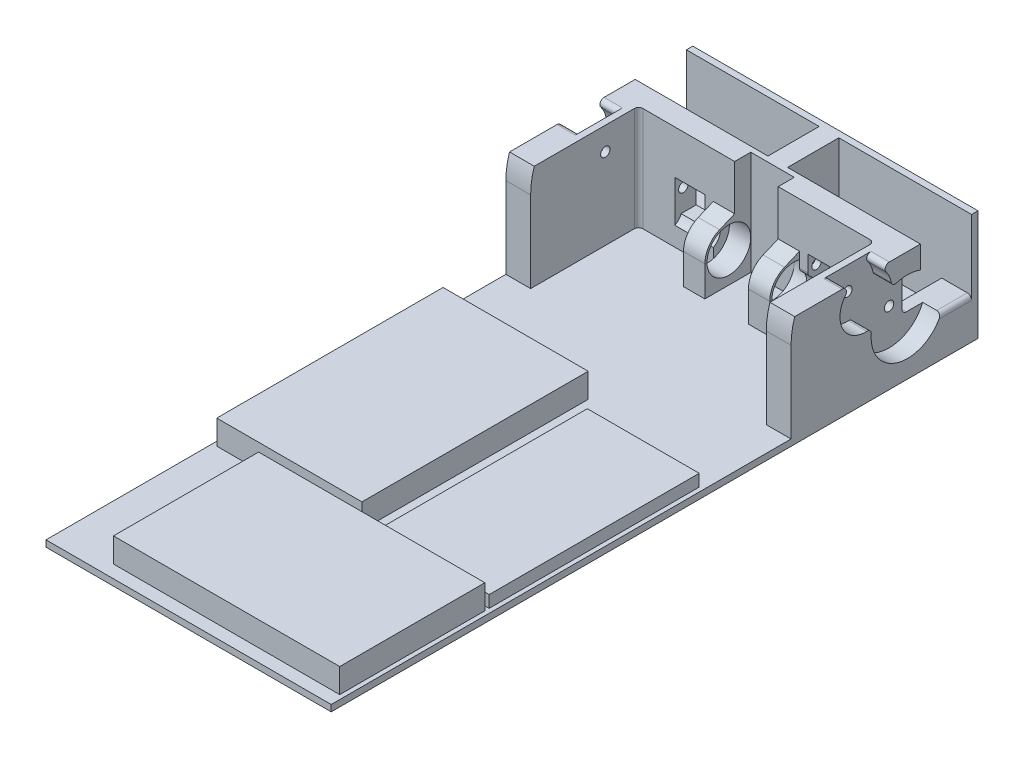
from build123d import *

# Parameters (mm, degrees)
SKETCH1_W            = 66.8
SKETCH1_H            = 150
BOSS_EXTRUDE1_DEPTH  = 1.75
SKETCH2_W            = 7
SKETCH2_H            = 12
SKETCH2_W_2          = 2.3
BOSS_EXTRUDE2_DEPTH  = 6
SKETCH3_W            = 19
SKETCH3_H            = 5
BOSS_EXTRUDE3_DEPTH  = 11.79
SKETCH4_R            = 1.1
CUT_EXTRUDE1_DEPTH   = 23.3
SKETCH33_R           = 1.1
BOSS_EXTRUDE21_DEPTH = 1.5
SKETCH8_R            = 8.5
CUT_EXTRUDE3_DEPTH   = 4.3
SKETCH5_W            = 7
SKETCH5_H            = 7.697712298
CUT_EXTRUDE4_DEPTH   = 5
BOSS_EXTRUDE6_DEPTH  = 5
BOSS_EXTRUDE23_DEPTH = 4.3
CUT_EXTRUDE6_REACH   = 92.003
SKETCH36_R           = 3
SKETCH34_W           = 10
SKETCH34_H           = 5
BOSS_EXTRUDE24_DEPTH = 10.61
BOSS_EXTRUDE25_DEPTH = 4.3
BOSS_EXTRUDE26_DEPTH = 5
FILLET7_R            = 1
SKETCH44_W           = 5
SKETCH44_H           = 10.61
BOSS_EXTRUDE30_DEPTH = 14
SKETCH45_W           = 7
SKETCH45_H           = 0.4
CUT_EXTRUDE8_DEPTH   = 5
FILLET7_OF_MIRROR5_R = 1
SKETCH30_R           = 1.1
BOSS_EXTRUDE19_DEPTH = 0.6
SKETCH28_W           = 4.6
SKETCH28_H           = 12
BOSS_EXTRUDE31_DEPTH = 16.4
SKETCH47_W           = 66.8
SKETCH47_H           = 25.9
BOSS_EXTRUDE32_DEPTH = 1.5
SKETCH50_W           = 1.227389953
SKETCH50_H           = 22.4
BOSS_EXTRUDE33_DEPTH = 10.2
CUT_EXTRUDE9_DEPTH   = 2
SKETCH52_W           = 34
SKETCH52_H           = 53
SKETCH52_W_2         = 53
SKETCH52_H_2         = 34
BOSS_EXTRUDE34_DEPTH = 5.7
SKETCH53_W           = 26.2
SKETCH53_H           = 49.2
BOSS_EXTRUDE35_DEPTH = 2.8


# Read off the part's stored shape, not the designer's step: Boss-Extrude6
with BuildPart() as part:
    # Sketch1 → Boss-Extrude1 (new, symmetric)
    with BuildSketch(Plane(origin=(0, 0, 0), x_dir=(1, 0, 0), z_dir=(0, 1, 0))):
        Rectangle(SKETCH1_W, SKETCH1_H)
    boss_extrude1 = extrude(amount=BOSS_EXTRUDE1_DEPTH, both=True)

    # Sketch2 → Boss-Extrude2 (add)
    with BuildSketch(Plane(origin=(0, 1.75, 0), x_dir=(1, 0, 0), z_dir=(0, 1, 0))):
        with Locations((-29.9, 69)):
            Rectangle(SKETCH2_W, SKETCH2_H)
        with Locations((-1.15, 69)):
            Rectangle(SKETCH2_W_2, SKETCH2_H)
    boss_extrude2 = extrude(amount=BOSS_EXTRUDE2_DEPTH)

    # Sketch3 → Boss-Extrude3 (add)
    with BuildSketch(Plane(origin=(0, 1.75, 0), x_dir=(1, 0, 0), z_dir=(0, 1, 0))):
        with Locations((-19.6, 60.5)):
            Rectangle(SKETCH3_W, SKETCH3_H)
    boss_extrude3 = extrude(amount=BOSS_EXTRUDE3_DEPTH)

    # Sketch4 → Cut-Extrude1 (cut)
    with BuildSketch(Plane.ZY.offset(33.4)):
        with Locations((-59.97, 10.94)):
            Circle(SKETCH4_R)
    cut_extrude1 = extrude(amount=-CUT_EXTRUDE1_DEPTH, mode=Mode.SUBTRACT)

    # Sketch33 → Boss-Extrude21 (add)
    with BuildSketch(Plane.ZY.offset(29.1)):
        with BuildLine():
            Line((-58, 1.75), (-32.714619908, 1.75))
            Line((-32.714619908, 1.75), (-32.714619908, 18.755533204))
            ThreePointArc((-32.714619908, 18.755533204), (-32.928979134, 21.486214993), (-33.566805397, 24.15))
            Line((-33.566805397, 24.15), (-58, 24.15))
            Line((-58, 24.15), (-58, 1.75))
        make_face()
        with Locations((-50.214619908, 18.755533204)):
            Circle(SKETCH33_R, mode=Mode.SUBTRACT)
    boss_extrude21 = extrude(amount=-BOSS_EXTRUDE21_DEPTH)

    # Sketch8 → Cut-Extrude3 (cut)
    with BuildSketch(Plane.ZY.offset(29.1)):
        with Locations((-59.97, 10.94)):
            Circle(SKETCH8_R)
    cut_extrude3 = extrude(amount=CUT_EXTRUDE3_DEPTH, mode=Mode.SUBTRACT)

    # Sketch5 → Cut-Extrude4 (cut)
    with BuildSketch(Plane.XY.offset(-58)):
        with Locations((-15.6, 9.691143851)):
            Rectangle(SKETCH5_W, SKETCH5_H)
    cut_extrude4 = extrude(amount=-CUT_EXTRUDE4_DEPTH, mode=Mode.SUBTRACT)

    # Boss-Extrude6 outline → Boss-Extrude6 (add)
    with BuildSketch(Plane(origin=(-10.1, 0, 0), x_dir=(0, 0, -1), z_dir=(1, 0, 0))):
        with BuildLine():
            Line((63, 1.75), (63, 13.54))
            Line((63, 13.54), (58, 13.54))
            Line((58, 13.54), (54.474415859, 12.063241708))
            ThreePointArc((54.474415859, 12.063241708), (51.964403757, 9.99079907), (51.022610047, 6.875))
            Line((51.022610047, 6.875), (51.022610047, 1.75))
            Line((51.022610047, 1.75), (56.647610047, 1.75))
            ThreePointArc((56.647610047, 1.75), (55.965342342, 11.954383405), (58, 1.93165433))
            Line((58, 1.93165433), (58, 1.75))
            Line((58, 1.75), (63, 1.75))
        make_face()
    boss_extrude6 = extrude(amount=BOSS_EXTRUDE6_DEPTH)

    # Sketch35 → Boss-Extrude23 (add)
    with BuildSketch(Plane.ZY.offset(29.1)):
        with BuildLine():
            ThreePointArc((-51.696668378, 12.889867655), (-54.372371702, 4.543394851), (-63, 2.998394369))
            Line((-63, 2.998394369), (-63, 1.75))
            Line((-63, 1.75), (-32.714619908, 1.75))
            Line((-32.714619908, 1.75), (-32.714619908, 18.755533204))
            ThreePointArc((-32.714619908, 18.755533204), (-32.928979134, 21.486214993), (-33.566805397, 24.15))
            Line((-33.566805397, 24.15), (-47.475600378, 24.15))
            ThreePointArc((-47.475600378, 24.15), (-44.549583353, 16.631889912), (-51.696668378, 12.889867655))
        make_face()
        with BuildLine():
            ThreePointArc((-58, 19.208560939), (-57.114293593, 18.945931608), (-56.262320095, 18.588732556))
            ThreePointArc((-56.262320095, 18.588732556), (-55.413998212, 21.848907617), (-52.953639439, 24.15))
            Line((-52.953639439, 24.15), (-58, 24.15))
            Line((-58, 24.15), (-58, 19.208560939))
        make_face()
    boss_extrude23 = extrude(amount=BOSS_EXTRUDE23_DEPTH)

    # Cut-Extrude6: up to this face of the body (flat: up to its plane)
    cut_extrude6_end = Plane(part.part.faces().sort_by_distance((-19.1, 9.554283394, -60.558081983))[0])
    # Sketch36 → Cut-Extrude6 (cut, up to the picked face)
    with BuildSketch(Plane.ZY.offset(10.1), mode=Mode.PRIVATE) as cut_extrude6_sk1:
        with Locations((-56.647610047, 6.875)):
            Circle(SKETCH36_R)
    cut_extrude6_tool1 = split(extrude(cut_extrude6_sk1.sketch, amount=CUT_EXTRUDE6_REACH, mode=Mode.PRIVATE), bisect_by=cut_extrude6_end, keep=Keep.BOTH, mode=Mode.PRIVATE)
    cut_extrude6 = cut_extrude6_tool1.solids().sort_by(Axis((-10.1, 6.875, -56.64761), (-1, 0, 0)))[0]
    add(cut_extrude6, mode=Mode.SUBTRACT)

    # Sketch34 → Boss-Extrude24 (add)
    with BuildSketch(Plane(origin=(0, 13.54, 0), x_dir=(1, 0, 0), z_dir=(0, 1, 0))):
        with Locations((-24.1, 60.5)):
            Rectangle(SKETCH34_W, SKETCH34_H)
    boss_extrude24 = extrude(amount=BOSS_EXTRUDE24_DEPTH)

    # Sketch37 → Boss-Extrude25 (add)
    with BuildSketch(Plane.ZY.offset(29.1)):
        with BuildLine():
            Line((-58, 24.15), (-63, 24.15))
            Line((-63, 24.15), (-63, 18.881605631))
            ThreePointArc((-63, 18.881605631), (-60.524639471, 19.421885112), (-58, 19.208560939))
            Line((-58, 19.208560939), (-58, 24.15))
        make_face()
    boss_extrude25 = extrude(amount=BOSS_EXTRUDE25_DEPTH)

    # Sketch38 → Boss-Extrude26 (add)
    with BuildSketch(Plane.ZY.offset(10.1)):
        with BuildLine():
            Line((-56.647610047, 1.75), (-58.2, 1.75))
            Line((-58.2, 1.75), (-58.2, 1.99076921))
            ThreePointArc((-58.2, 1.99076921), (-57.433085123, 1.810549991), (-56.647610047, 1.75))
        make_face()
    boss_extrude26 = extrude(amount=-BOSS_EXTRUDE26_DEPTH)

    # Fillet7
    fillet7_edges = [part.edges().sort_by_distance(p)[0] for p in [
        (-31.25, 12.889867655, -51.696668378),
        (-31.25, 24.15, -47.475600378),
        (-31.25, 18.588732556, -56.262320095),
        (-31.25, 24.15, -52.953639439),
        (-11.1, 9.552880023, -58),
        (-33.4, 7.75, -71.424349566),
        (-27.75, 7.75, -63),
        (-27.6, 12.95, -58),
    ]]
    fillet(fillet7_edges, radius=FILLET7_R)

    # Sketch44 → Boss-Extrude30 (add)
    with BuildSketch(Plane(origin=(-19.1, 0, 0), x_dir=(0, 0, -1), z_dir=(1, 0, 0))):
        with Locations((60.5, 18.845)):
            Rectangle(SKETCH44_W, SKETCH44_H)
    boss_extrude30 = extrude(amount=BOSS_EXTRUDE30_DEPTH)

    # Sketch45 → Cut-Extrude8 (cut)
    with BuildSketch(Plane.XY.offset(-58)):
        with Locations((-15.6, 13.74)):
            Rectangle(SKETCH45_W, SKETCH45_H)
    cut_extrude8 = extrude(amount=-CUT_EXTRUDE8_DEPTH, mode=Mode.SUBTRACT)

    # Mirror5: Boss-Extrude1, Boss-Extrude2, Boss-Extrude3, Cut-Extrude1, Boss-Extrude21, Cut-Extrude3, Cut-Extrude4, Boss-Extrude6, Boss-Extrude23, Cut-Extrude6, Boss-Extrude24, Boss-Extrude25, Boss-Extrude26, Boss-Extrude30, Cut-Extrude8 across plane
    add(boss_extrude1.mirror(Plane(origin=(0, 0, 0), x_dir=(0, 0, 1), z_dir=(1, 0, 0))))
    add(boss_extrude2.mirror(Plane(origin=(0, 0, 0), x_dir=(0, 0, 1), z_dir=(1, 0, 0))))
    add(boss_extrude3.mirror(Plane(origin=(0, 0, 0), x_dir=(0, 0, 1), z_dir=(1, 0, 0))))
    add(cut_extrude1.mirror(Plane(origin=(0, 0, 0), x_dir=(0, 0, 1), z_dir=(1, 0, 0))), mode=Mode.SUBTRACT)
    add(boss_extrude21.mirror(Plane(origin=(0, 0, 0), x_dir=(0, 0, 1), z_dir=(1, 0, 0))))
    add(cut_extrude3.mirror(Plane(origin=(0, 0, 0), x_dir=(0, 0, 1), z_dir=(1, 0, 0))), mode=Mode.SUBTRACT)
    add(cut_extrude4.mirror(Plane(origin=(0, 0, 0), x_dir=(0, 0, 1), z_dir=(1, 0, 0))), mode=Mode.SUBTRACT)
    add(boss_extrude6.mirror(Plane(origin=(0, 0, 0), x_dir=(0, 0, 1), z_dir=(1, 0, 0))))
    add(boss_extrude23.mirror(Plane(origin=(0, 0, 0), x_dir=(0, 0, 1), z_dir=(1, 0, 0))))
    add(cut_extrude6.mirror(Plane(origin=(0, 0, 0), x_dir=(0, 0, 1), z_dir=(1, 0, 0))), mode=Mode.SUBTRACT)
    add(boss_extrude24.mirror(Plane(origin=(0, 0, 0), x_dir=(0, 0, 1), z_dir=(1, 0, 0))))
    add(boss_extrude25.mirror(Plane(origin=(0, 0, 0), x_dir=(0, 0, 1), z_dir=(1, 0, 0))))
    add(boss_extrude26.mirror(Plane(origin=(0, 0, 0), x_dir=(0, 0, 1), z_dir=(1, 0, 0))))
    add(boss_extrude30.mirror(Plane(origin=(0, 0, 0), x_dir=(0, 0, 1), z_dir=(1, 0, 0))))
    add(cut_extrude8.mirror(Plane(origin=(0, 0, 0), x_dir=(0, 0, 1), z_dir=(1, 0, 0))), mode=Mode.SUBTRACT)

    # Fillet7 of Mirror5
    fillet7_of_mirror5_edges = [part.edges().sort_by_distance(p)[0] for p in [
        (31.25, 12.889867655, -51.696668378),
        (31.25, 24.15, -47.475600378),
        (31.25, 18.588732556, -56.262320095),
        (31.25, 24.15, -52.953639439),
        (11.1, 9.552880023, -58),
        (33.4, 7.75, -71.424349566),
        (27.75, 7.75, -63),
        (27.6, 12.95, -58),
    ]]
    fillet(fillet7_of_mirror5_edges, radius=FILLET7_OF_MIRROR5_R)

    # Sketch30 → Boss-Extrude19 (add)
    with BuildSketch(Plane(origin=(-10.1, 0, 0), x_dir=(0, 0, -1), z_dir=(1, 0, 0))):
        with Locations(Location((59.97, 10.94, 0), (0, 0, 90))):
            Circle(SKETCH30_R)
    boss_extrude19 = extrude(amount=-BOSS_EXTRUDE19_DEPTH)

    # Mirror6: Boss-Extrude19 across plane
    add(boss_extrude19.mirror(Plane(origin=(0, 0, 0), x_dir=(0, 0, 1), z_dir=(1, 0, 0))))

    # Sketch28 → Boss-Extrude31 (add)
    with BuildSketch(Plane(origin=(0, 7.75, 0), x_dir=(1, 0, 0), z_dir=(0, 1, 0))):
        with Locations((0, 69)):
            Rectangle(SKETCH28_W, SKETCH28_H)
    extrude(amount=BOSS_EXTRUDE31_DEPTH)

    # Sketch47 → Boss-Extrude32 (add)
    with BuildSketch(Plane(origin=(0, 0, -75), x_dir=(-1, 0, 0), z_dir=(0, 0, -1))):
        with Locations((0, 11.2)):
            Rectangle(SKETCH47_W, SKETCH47_H)
    extrude(amount=BOSS_EXTRUDE32_DEPTH)

    # Sketch50 → Boss-Extrude33 (add)
    with BuildSketch(Plane.ZY.offset(-5.1)):
        with Locations((-62.386305024, 12.95)):
            Rectangle(SKETCH50_W, SKETCH50_H)
    extrude(amount=BOSS_EXTRUDE33_DEPTH)

    # Sketch51 → Cut-Extrude9 (cut)
    with BuildSketch(Plane(origin=(0, 1.75, 0), x_dir=(1, 0, 0), z_dir=(0, 1, 0))):
        with BuildLine():
            Line((-33.4, 32.714619908), (-33.4, -75))
            Line((-33.4, -75), (33.4, -75))
            Line((33.4, -75), (33.4, 32.714619908))
            Line((33.4, 32.714619908), (27.6, 32.714619908))
            Line((27.6, 32.714619908), (27.6, 57))
            ThreePointArc((27.6, 57), (27.307106781, 57.707106781), (26.6, 58))
            Line((26.6, 58), (10.1, 58))
            Line((10.1, 58), (10.1, 56.647610047))
            Line((10.1, 56.647610047), (10.1, 51.022610047))
            Line((10.1, 51.022610047), (5.1, 51.022610047))
            Line((5.1, 51.022610047), (5.1, 56.647610047))
            Line((5.1, 56.647610047), (5.1, 61.772610047))
            Line((5.1, 61.772610047), (-5.1, 61.772610047))
            Line((-5.1, 61.772610047), (-5.1, 56.647610047))
            Line((-5.1, 56.647610047), (-5.1, 51.022610047))
            Line((-5.1, 51.022610047), (-10.1, 51.022610047))
            Line((-10.1, 51.022610047), (-10.1, 56.647610047))
            Line((-10.1, 56.647610047), (-10.1, 58))
            Line((-10.1, 58), (-26.6, 58))
            ThreePointArc((-26.6, 58), (-27.307106781, 57.707106781), (-27.6, 57))
            Line((-27.6, 57), (-27.6, 32.714619908))
            Line((-27.6, 32.714619908), (-33.4, 32.714619908))
        make_face()
    extrude(amount=-CUT_EXTRUDE9_DEPTH, mode=Mode.SUBTRACT)

    # Sketch52 → Boss-Extrude34 (add)
    with BuildSketch(Plane(origin=(0, -0.25, 0), x_dir=(1, 0, 0), z_dir=(0, 1, 0))):
        with Locations((-15.4, -9.5)):
            Rectangle(SKETCH52_W, SKETCH52_H)
        with Locations((5.9, -55)):
            Rectangle(SKETCH52_W_2, SKETCH52_H_2)
    extrude(amount=BOSS_EXTRUDE34_DEPTH)

    # Sketch53 → Boss-Extrude35 (add)
    with BuildSketch(Plane(origin=(0, -0.25, 0), x_dir=(1, 0, 0), z_dir=(0, 1, 0))):
        with Locations((19.3, -12.4)):
            Rectangle(SKETCH53_W, SKETCH53_H)
    extrude(amount=BOSS_EXTRUDE35_DEPTH)


solid = part.part
